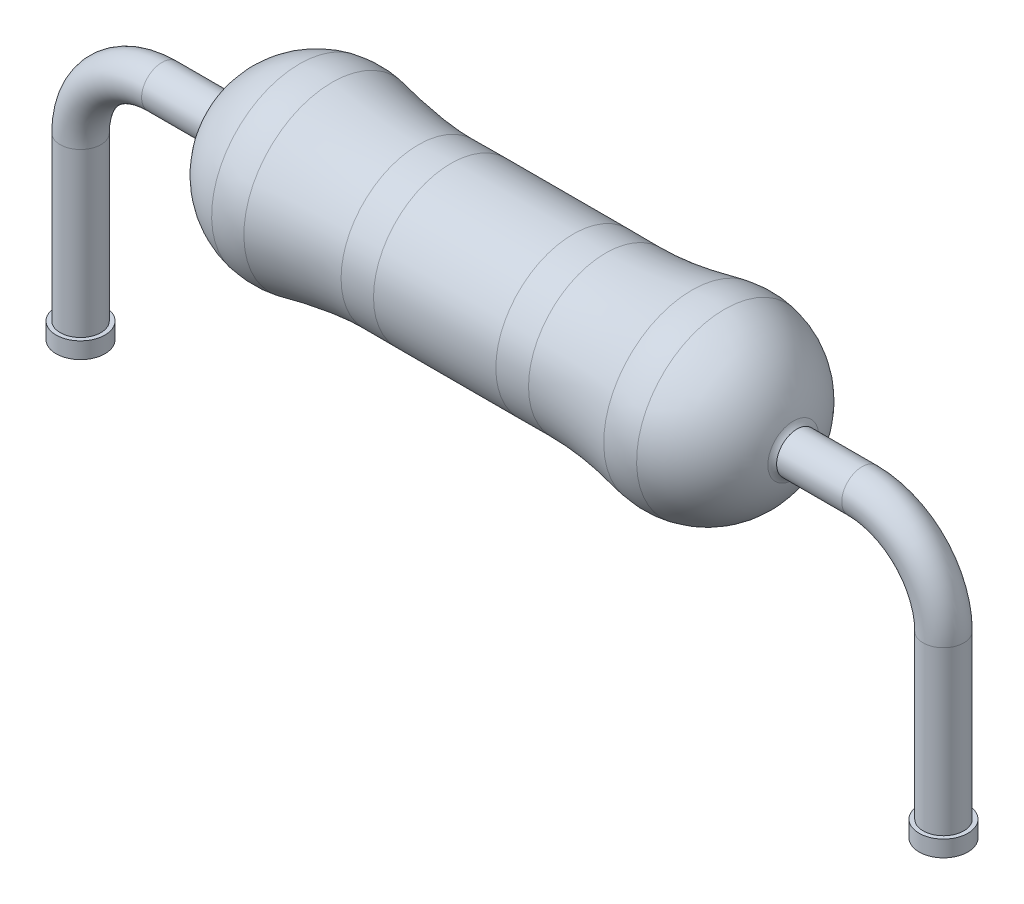
from build123d import *

# Parameters (mm, degrees)
SKETCH3_R           = 0.25
SKETCH14_R          = 0.25
SKETCH16_R          = 0.3
BOSS_EXTRUDE1_DEPTH = 0.2
SKETCH17_R          = 0.3
BOSS_EXTRUDE2_DEPTH = 0.2


with BuildPart() as part:
    # Sketch1 → Revolve1 (revolve)
    with BuildSketch(Plane.XY):
        with BuildLine():
            Line((3.5, 0), (3.5, 0.25))
            add(Edge.make_bspline(
                [(3.5, 0.25), (3.471344604, 0.276701022), (3.454772558, 0.312177594)],
                knots=[0, 0, 0, 1, 1, 1], degree=2))
            ThreePointArc((3.454772558, 0.312177594), (2.97941585, 0.935027953), (2.210086251, 1.08348178))
            add(Edge.make_bspline(
                [(0.751281558, 0.95), (0.922733788, 0.954106797), (1.413540999, 0.927963205), (1.898117434, 1.017502465), (2.210086251, 1.08348178)],
                knots=[0, 0, 0, 0, 0.350784109, 1, 1, 1, 1], degree=3))
            Line((0.751281558, 0.95), (-0.751281558, 0.95))
            add(Edge.make_bspline(
                [(-0.751281558, 0.95), (-0.922733788, 0.954106797), (-1.413540999, 0.927963205), (-1.898117434, 1.017502465), (-2.210086251, 1.08348178)],
                knots=[0, 0, 0, 0, 0.350784109, 1, 1, 1, 1], degree=3))
            ThreePointArc((-2.210086251, 1.08348178), (-2.97941585, 0.935027953), (-3.454772558, 0.312177594))
            add(Edge.make_bspline(
                [(-3.5, 0.25), (-3.471344604, 0.276701022), (-3.454772558, 0.312177594)],
                knots=[0, 0, 0, 1, 1, 1], degree=2))
            Line((-3.5, 0.25), (-3.5, 0))
            Line((-3.5, 0), (3.5, 0))
        make_face()
    revolve(axis=Axis((-6.223683814, 0, 0), (1, 0, 0)))

    # Sweep1: sweep along a path in Sketch5
    with BuildLine(Plane.XY) as sweep1_path:
        Line((-3.5, 0), (-4.3, 0))
        ThreePointArc((-4.3, 0), (-5.007106781, -0.292893219), (-5.3, -1))
        Line((-5.3, -1), (-5.3, -3))
    # Sketch3 → Sweep1 (sweep)
    with BuildSketch(Plane.ZY.offset(3.5)):
        Circle(SKETCH3_R)
    sweep(path=sweep1_path.line)

    # Sweep2: sweep along a path in Sketch15
    with BuildLine(Plane.XY) as sweep2_path:
        Line((3.5, 0), (4.3, 0))
        ThreePointArc((4.3, 0), (5.007106781, -0.292893219), (5.3, -1))
        Line((5.3, -1), (5.3, -3))
    # Sketch14 → Sweep2 (sweep)
    with BuildSketch(Plane(origin=(3.5, 0, 0), x_dir=(0, 0, -1), z_dir=(1, 0, 0))):
        Circle(SKETCH14_R)
    sweep(path=sweep2_path.line)

    # Sketch16 → Boss-Extrude1 (add)
    with BuildSketch(Plane.XZ.offset(3)):
        with Locations((-5.3, 0)):
            Circle(SKETCH16_R)
    extrude(amount=BOSS_EXTRUDE1_DEPTH)

    # Sketch17 → Boss-Extrude2 (add)
    with BuildSketch(Plane.XZ.offset(3)):
        with Locations((5.3, 0)):
            Circle(SKETCH17_R)
    extrude(amount=BOSS_EXTRUDE2_DEPTH)


solid = part.part
